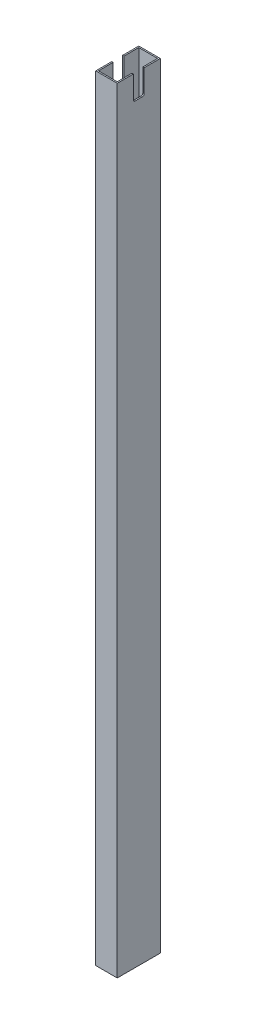
from build123d import *

# Parameters (mm, degrees)
SKETCH1_W           = 25.4
SKETCH1_H           = 50.8
SKETCH1_W_2         = 22.225
SKETCH1_H_2         = 47.625
EXTRUDE_THIN1_DEPTH = 914.4
CUT_EXTRUDE1_DEPTH  = 916.10528356


with BuildPart() as part:
    # Sketch1 → Extrude-Thin1 (new body)
    with BuildSketch(Plane(origin=(0, 0, 0), x_dir=(1, 0, 0), z_dir=(0, 1, 0))):
        Rectangle(SKETCH1_W, SKETCH1_H)
        Rectangle(SKETCH1_W_2, SKETCH1_H_2, mode=Mode.SUBTRACT)
    extrude(amount=EXTRUDE_THIN1_DEPTH)

    # Sketch2 → Cut-Extrude1 (cut, through all)
    with BuildSketch(Plane.ZY.offset(12.7)):
        with BuildLine():
            Line((-6.35, 914.4), (6.35, 914.4))
            Line((6.35, 914.4), (6.35, 887.603))
            ThreePointArc((6.35, 887.603), (5.829235857, 886.345764143), (4.572, 885.825))
            Line((4.572, 885.825), (-4.572, 885.825))
            ThreePointArc((-4.572, 885.825), (-5.829235857, 886.345764143), (-6.35, 887.603))
            Line((-6.35, 887.603), (-6.35, 914.4))
        make_face()
    extrude(amount=-CUT_EXTRUDE1_DEPTH, mode=Mode.SUBTRACT)


solid = part.part
